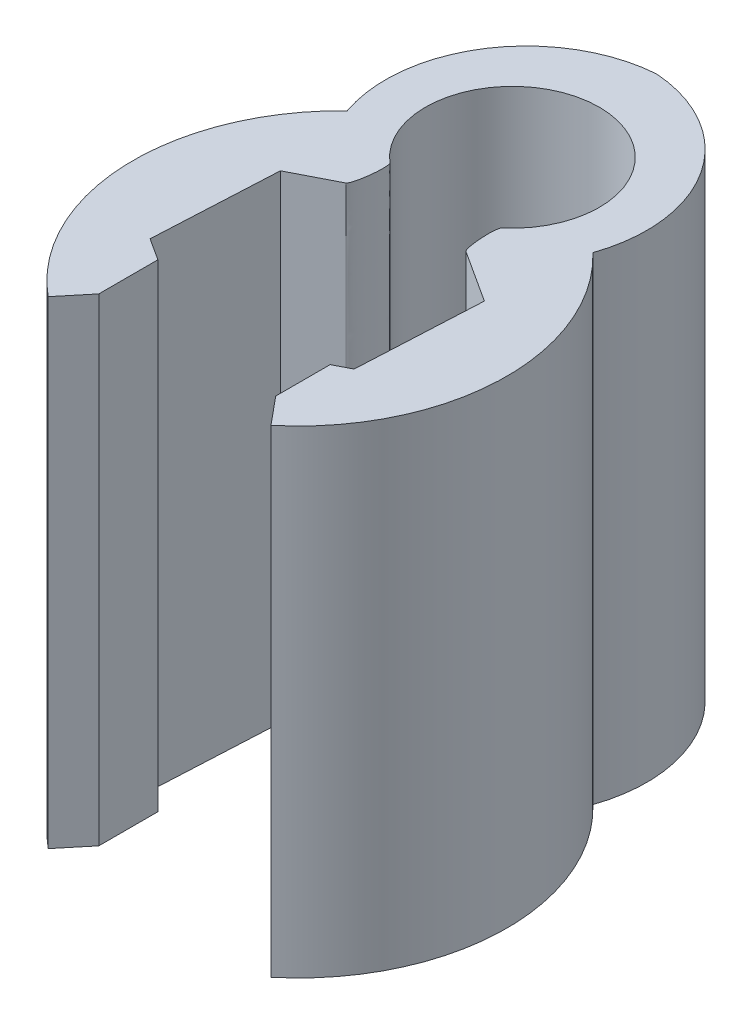
from build123d import *

# Parameters (mm, degrees)
BOSS_EXTRUDE1_DEPTH = 25.4


with BuildPart() as part:
    # Sketch3 → Boss-Extrude1 (new body)
    with BuildSketch(Plane(origin=(0, 0, 0), x_dir=(1, 0, 0), z_dir=(0, 1, 0))):
        with BuildLine():
            Line((-5.541525375, 3.58326618), (-2.47962532, 5.150959008))
            Line((-2.47962532, 5.150959008), (-2.47962532, 6.474170352))
            ThreePointArc((-2.47962532, 6.474170352), (-2.221563685, 14.417025562), (4.617359972, 10.369227654))
            ThreePointArc((4.617359972, 10.369227654), (4.047797908, 8.147663968), (2.47962532, 6.474170352))
            Line((2.47962532, 6.474170352), (2.47962532, 5.20231788))
            Line((2.47962532, 5.20231788), (5.873962228, 3.007468661))
            Line((5.873962228, 3.007468661), (5.541525375, -3.58326618))
            Line((5.541525375, -3.58326618), (4.701204968, -4.013510228))
            Line((4.701204968, -4.013510228), (4.701204968, -6.905610932))
            Line((4.701204968, -6.905610932), (5.918780254, -8.378526195))
            ThreePointArc((5.918780254, -8.378526195), (9.922634137, -0.265088751), (6.526624698, 8.120961152))
            ThreePointArc((6.526624698, 8.120961152), (5.706991897, 14.686716316), (0, 18.035026682))
            ThreePointArc((0, 18.035026682), (-5.706991897, 14.686716316), (-6.526624698, 8.120961152))
            ThreePointArc((-6.526624698, 8.120961152), (-9.922634137, -0.265088751), (-5.918780254, -8.378526195))
            Line((-5.918780254, -8.378526195), (-4.701204968, -6.905610932))
            Line((-4.701204968, -6.905610932), (-4.701204968, -3.765798027))
            Line((-4.701204968, -3.765798027), (-5.873962228, -3.007468661))
            Line((-5.873962228, -3.007468661), (-5.541525375, 3.58326618))
        make_face()
        with BuildLine():
            Line((-2.47962532, 6.474170352), (-2.47962532, 5.150959008))
            Line((-2.47962532, 5.150959008), (-1.063503338, 5.876013463))
            ThreePointArc((-1.063503338, 5.876013463), (-1.79663243, 6.115743784), (-2.47962532, 6.474170352))
        make_face()
        with BuildLine():
            ThreePointArc((2.47962532, 6.474170352), (1.921985685, 6.17089654), (1.328021538, 5.946968965))
            Line((1.328021538, 5.946968965), (2.47962532, 5.20231788))
            Line((2.47962532, 5.20231788), (2.47962532, 6.474170352))
        make_face()
    extrude(amount=BOSS_EXTRUDE1_DEPTH)

    # Fillet6
    # a fillet whose section is not a circle: 1.27 mm, written as the material it takes off along each edge
    with BuildSketch(Plane(origin=(1.328021538, -5.283304691, -5.946968965), x_dir=(0.8397378391322112, 0, 0.5429920455490709), z_dir=(0, 1, 0))) as fillet6_piece_1:
        with BuildLine():
            Bezier((2.113321876, 0), (0.3966534, 0), (0.898889741, 1.641556979), weights=[1, 0.118948346, 1])
            ThreePointArc((0.898889741, 1.641556979), (0.533488386, 0.774757636), (0, 0))
            Line((0, 0), (2.113321876, 0))
        make_face()
    extrude(amount=35.966609382, mode=Mode.SUBTRACT)
    with BuildSketch(Plane(origin=(-1.063503338, -6.120582224, -5.876013463), x_dir=(-0.891835980226881, 0, -0.4523589110128793), z_dir=(0, 1, 0))) as fillet6_piece_2:
        with BuildLine():
            Bezier((2.168149873, 0), (0.323600022, 0.445521101), (1.438773255, 1.980852292), weights=[1, 0.11123936, 1])
            Line((1.438773255, 1.980852292), (0, 0))
            ThreePointArc((0, 0), (1.084074937, 0.129064678), (2.168149873, 0))
        make_face()
    extrude(amount=37.641164449, mode=Mode.SUBTRACT)


solid = part.part
